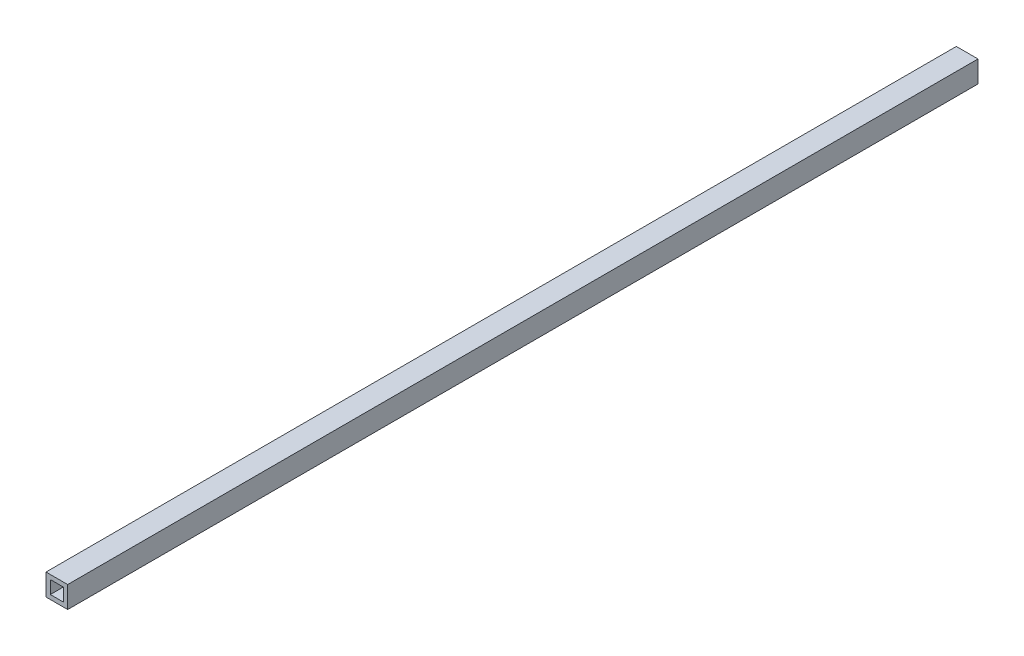
from build123d import *

# Parameters (mm, degrees)
SKETCH1_W                 = 50
SKETCH1_H                 = 50
SKETCH1_W_2               = 30
SKETCH1_H_2               = 30
BOSS_EXTRUDE1_DEPTH       = 2100
SKETCH2_W                 = 50
SKETCH2_H                 = 50
BOSS_EXTRUDE2_DEPTH       = 5100
SKETCH4_W                 = 50
SKETCH4_H                 = 50
SKETCH4_W_2               = 30
SKETCH4_H_2               = 30
BOSS_EXTRUDE3_DEPTH       = 2100
SKETCH5_W                 = 50
SKETCH5_H                 = 50
BOSS_EXTRUDE4_DEPTH       = 1800
LPATTERN1_COUNT           = 2
LPATTERN1_PITCH           = 2000
SKETCH6_W                 = 100
SKETCH6_H                 = 150
BOSS_EXTRUDE5_DEPTH       = 5
SKETCH7_W                 = 100
SKETCH7_H                 = 150
BOSS_EXTRUDE6_DEPTH       = 5
SKETCH8_W                 = 100
SKETCH8_H                 = 150
BOSS_EXTRUDE7_DEPTH       = 5
SKETCH9_W                 = 100
SKETCH9_H                 = 150
BOSS_EXTRUDE8_DEPTH       = 5
SKETCH10_W                = 100
SKETCH10_H                = 5
BOSS_EXTRUDE9_DEPTH       = 20
SKETCH11_W                = 100
SKETCH11_H                = 5
BOSS_EXTRUDE10_DEPTH      = 20
SKETCH12_W                = 100
SKETCH12_H                = 5
BOSS_EXTRUDE11_DEPTH      = 20
SKETCH13_W                = 100
SKETCH13_H                = 5
BOSS_EXTRUDE12_DEPTH      = 20
F_5_0MM_DOWEL_HOLE1_D     = 5
F_5_0MM_DOWEL_HOLE1_DEPTH = 20
F_5_0MM_DOWEL_HOLE1_TIP   = 1.502151548
F_5_0MM_DOWEL_HOLE2_D     = 5
F_5_0MM_DOWEL_HOLE2_DEPTH = 20
F_5_0MM_DOWEL_HOLE2_TIP   = 1.502151548
F_5_0MM_DOWEL_HOLE3_D     = 5
F_5_0MM_DOWEL_HOLE3_DEPTH = 20
F_5_0MM_DOWEL_HOLE3_TIP   = 1.502151548
F_5_0MM_DOWEL_HOLE4_D     = 5
F_5_0MM_DOWEL_HOLE4_DEPTH = 20
F_5_0MM_DOWEL_HOLE4_TIP   = 1.502151548
SKETCH26_W                = 5305.980467783
SKETCH26_H                = 67.779411833
CUT_EXTRUDE1_DEPTH        = 5613.586302232
SPLIT1_OUTLINE_W          = 5150
SPLIT1_OUTLINE_H          = 50
SPLIT1_OUTLINE_W_2        = 30
SPLIT1_OUTLINE_H_2        = 30
SPLIT1_DEPTH              = 2100
SPLIT1_START              = -5
SPLIT1_2_OUTLINE_W        = 100
SPLIT1_2_OUTLINE_H        = 120
SPLIT1_2_OUTLINE_R        = 2.5
SPLIT1_2_DEPTH            = 2110
SPLIT3_START              = -5
SPLIT3_OUTLINE_W          = 100
SPLIT3_OUTLINE_H          = 120
SPLIT3_OUTLINE_R          = 2.5
SPLIT3_DEPTH              = 5
SPLIT4_START              = 2100
SPLIT4_OUTLINE_W          = 100
SPLIT4_OUTLINE_H          = 120
SPLIT4_OUTLINE_R          = 2.5
SPLIT4_DEPTH              = 5


# Read off the part's stored shape, not the designer's step: Split1, Split3, Split4
with BuildPart() as part:
    # Sketch1 → Boss-Extrude1 (new body)
    with BuildSketch(Plane.XY):
        Rectangle(SKETCH1_W, SKETCH1_H)
        Rectangle(SKETCH1_W_2, SKETCH1_H_2, mode=Mode.SUBTRACT)
    extrude(amount=BOSS_EXTRUDE1_DEPTH)

    # Sketch2 → Boss-Extrude2 (add)
    with BuildSketch(Plane.ZY.offset(25)):
        with Locations((125, 0)):
            Rectangle(SKETCH2_W, SKETCH2_H)
        with Locations((1975, 0)):
            Rectangle(SKETCH2_W, SKETCH2_H)
    extrude(amount=BOSS_EXTRUDE2_DEPTH)

    # Sketch4 → Boss-Extrude3 (add)
    with BuildSketch(Plane.XY):
        with Locations((-5150, 0)):
            Rectangle(SKETCH4_W, SKETCH4_H)
        with Locations((-5150, 0)):
            Rectangle(SKETCH4_W_2, SKETCH4_H_2, mode=Mode.SUBTRACT)
    extrude(amount=BOSS_EXTRUDE3_DEPTH)

    # Sketch5 → Boss-Extrude4 (add)
    with BuildSketch(Plane(origin=(0, 0, 1950), x_dir=(-1, 0, 0), z_dir=(0, 0, -1))):
        with Locations((1550, 0)):
            Rectangle(SKETCH5_W, SKETCH5_H)
    boss_extrude4 = extrude(amount=BOSS_EXTRUDE4_DEPTH)

    # LPattern1: Boss-Extrude4 ×2
    with Locations(*[(-i * LPATTERN1_PITCH, 0, 0) for i in range(1, LPATTERN1_COUNT)]):
        add(boss_extrude4)

    # Sketch6 → Boss-Extrude5 (add)
    with BuildSketch(Plane(origin=(0, 0, 0), x_dir=(-1, 0, 0), z_dir=(0, 0, -1))):
        Rectangle(SKETCH6_W, SKETCH6_H)
    extrude(amount=BOSS_EXTRUDE5_DEPTH)

    # Sketch7 → Boss-Extrude6 (add)
    with BuildSketch(Plane(origin=(0, 0, 0), x_dir=(-1, 0, 0), z_dir=(0, 0, -1))):
        with Locations((5150, 0)):
            Rectangle(SKETCH7_W, SKETCH7_H)
    extrude(amount=BOSS_EXTRUDE6_DEPTH)

    # Sketch8 → Boss-Extrude7 (add)
    with BuildSketch(Plane.XY.offset(2100)):
        with Locations((-5150, 0)):
            Rectangle(SKETCH8_W, SKETCH8_H)
    extrude(amount=BOSS_EXTRUDE7_DEPTH)

    # Sketch9 → Boss-Extrude8 (add)
    with BuildSketch(Plane.XY.offset(2100)):
        Rectangle(SKETCH9_W, SKETCH9_H)
    extrude(amount=BOSS_EXTRUDE8_DEPTH)

    # Sketch10 → Boss-Extrude9 (add)
    with BuildSketch(Plane(origin=(0, 75, 0), x_dir=(1, 0, 0), z_dir=(0, 1, 0))):
        with Locations((0, -2102.5)):
            Rectangle(SKETCH10_W, SKETCH10_H)
    extrude(amount=BOSS_EXTRUDE9_DEPTH)

    # Sketch11 → Boss-Extrude10 (add)
    with BuildSketch(Plane(origin=(0, 75, 0), x_dir=(1, 0, 0), z_dir=(0, 1, 0))):
        with Locations((0, 2.5)):
            Rectangle(SKETCH11_W, SKETCH11_H)
    extrude(amount=BOSS_EXTRUDE10_DEPTH)

    # Sketch12 → Boss-Extrude11 (add)
    with BuildSketch(Plane(origin=(0, 75, 0), x_dir=(1, 0, 0), z_dir=(0, 1, 0))):
        with Locations((-5150, 2.5)):
            Rectangle(SKETCH12_W, SKETCH12_H)
    extrude(amount=BOSS_EXTRUDE11_DEPTH)

    # Sketch13 → Boss-Extrude12 (add)
    with BuildSketch(Plane(origin=(0, 75, 0), x_dir=(1, 0, 0), z_dir=(0, 1, 0))):
        with Locations((-5150, -2102.5)):
            Rectangle(SKETCH13_W, SKETCH13_H)
    extrude(amount=BOSS_EXTRUDE12_DEPTH)

    # Ø5.0mm Dowel Hole1
    with Locations(Plane(origin=(0, 0, -5), x_dir=(-1, 0, 0), z_dir=(0, 0, -1))):
        with Locations((5110, 75), (5190, 75), (5190, -15), (5110, -15)):
            Hole(F_5_0MM_DOWEL_HOLE1_D / 2, depth=F_5_0MM_DOWEL_HOLE1_DEPTH)
            with Locations((0, 0, -(F_5_0MM_DOWEL_HOLE1_DEPTH + F_5_0MM_DOWEL_HOLE1_TIP / 2))):  # 118° drill point
                Cone(0, F_5_0MM_DOWEL_HOLE1_D / 2, F_5_0MM_DOWEL_HOLE1_TIP, mode=Mode.SUBTRACT)

    # Ø5.0mm Dowel Hole2
    with Locations(Plane(origin=(0, 0, -5), x_dir=(-1, 0, 0), z_dir=(0, 0, -1))):
        with Locations((-40, -15), (-40, 75), (40, 75), (40, -15)):
            Hole(F_5_0MM_DOWEL_HOLE2_D / 2, depth=F_5_0MM_DOWEL_HOLE2_DEPTH)
            with Locations((0, 0, -(F_5_0MM_DOWEL_HOLE2_DEPTH + F_5_0MM_DOWEL_HOLE2_TIP / 2))):  # 118° drill point
                Cone(0, F_5_0MM_DOWEL_HOLE2_D / 2, F_5_0MM_DOWEL_HOLE2_TIP, mode=Mode.SUBTRACT)

    # Ø5.0mm Dowel Hole3
    with Locations(Plane.XY.offset(2105)):
        with Locations((-40, -15), (-40, 75), (40, 75), (40, -15)):
            Hole(F_5_0MM_DOWEL_HOLE3_D / 2, depth=F_5_0MM_DOWEL_HOLE3_DEPTH)
            with Locations((0, 0, -(F_5_0MM_DOWEL_HOLE3_DEPTH + F_5_0MM_DOWEL_HOLE3_TIP / 2))):  # 118° drill point
                Cone(0, F_5_0MM_DOWEL_HOLE3_D / 2, F_5_0MM_DOWEL_HOLE3_TIP, mode=Mode.SUBTRACT)

    # Ø5.0mm Dowel Hole4
    with Locations(Plane.XY.offset(2105)):
        with Locations((-5190, 75), (-5110, 75), (-5110, -15), (-5190, -15)):
            Hole(F_5_0MM_DOWEL_HOLE4_D / 2, depth=F_5_0MM_DOWEL_HOLE4_DEPTH)
            with Locations((0, 0, -(F_5_0MM_DOWEL_HOLE4_DEPTH + F_5_0MM_DOWEL_HOLE4_TIP / 2))):  # 118° drill point
                Cone(0, F_5_0MM_DOWEL_HOLE4_D / 2, F_5_0MM_DOWEL_HOLE4_TIP, mode=Mode.SUBTRACT)

    # Sketch26 → Cut-Extrude1 (cut, through all)
    with BuildSketch(Plane.XY.offset(2105)):
        with Locations((-2547.009766109, -58.889705917)):
            Rectangle(SKETCH26_W, SKETCH26_H)
    extrude(amount=-CUT_EXTRUDE1_DEPTH, mode=Mode.SUBTRACT)

    # Split1 outline → Split1 (cut)
    with BuildSketch(Plane.XY):
        with Locations((-2600, 0)):
            Rectangle(SPLIT1_OUTLINE_W, SPLIT1_OUTLINE_H)
        with Locations((-5150, 0)):
            Rectangle(SPLIT1_OUTLINE_W_2, SPLIT1_OUTLINE_H_2, mode=Mode.SUBTRACT)
    extrude(amount=SPLIT1_DEPTH, mode=Mode.SUBTRACT)

    # Split1 2 outline → Split1 2 (cut)
    with BuildSketch(Plane.XY.offset(SPLIT1_START)):
        with Locations((-5150, 35)):
            Rectangle(SPLIT1_2_OUTLINE_W, SPLIT1_2_OUTLINE_H)
        with Locations((-5190, -15)):
            Circle(SPLIT1_2_OUTLINE_R, mode=Mode.SUBTRACT)
        with Locations((-5190, 75)):
            Circle(SPLIT1_2_OUTLINE_R, mode=Mode.SUBTRACT)
        with Locations((-5110, 75)):
            Circle(SPLIT1_2_OUTLINE_R, mode=Mode.SUBTRACT)
        with Locations((-5110, -15)):
            Circle(SPLIT1_2_OUTLINE_R, mode=Mode.SUBTRACT)
    extrude(amount=SPLIT1_2_DEPTH, mode=Mode.SUBTRACT)

    # Split3 outline → Split3 (cut)
    with BuildSketch(Plane.XY.offset(SPLIT3_START)):
        with Locations((0, 35)):
            Rectangle(SPLIT3_OUTLINE_W, SPLIT3_OUTLINE_H)
        with Locations((-40, -15)):
            Circle(SPLIT3_OUTLINE_R, mode=Mode.SUBTRACT)
        with Locations((40, -15)):
            Circle(SPLIT3_OUTLINE_R, mode=Mode.SUBTRACT)
        with Locations((-40, 75)):
            Circle(SPLIT3_OUTLINE_R, mode=Mode.SUBTRACT)
        with Locations((40, 75)):
            Circle(SPLIT3_OUTLINE_R, mode=Mode.SUBTRACT)
    extrude(amount=SPLIT3_DEPTH, mode=Mode.SUBTRACT)

    # Split4 outline → Split4 (cut)
    with BuildSketch(Plane.XY.offset(SPLIT4_START)):
        with Locations((0, 35)):
            Rectangle(SPLIT4_OUTLINE_W, SPLIT4_OUTLINE_H)
        with Locations((-40, -15)):
            Circle(SPLIT4_OUTLINE_R, mode=Mode.SUBTRACT)
        with Locations((40, -15)):
            Circle(SPLIT4_OUTLINE_R, mode=Mode.SUBTRACT)
        with Locations((-40, 75)):
            Circle(SPLIT4_OUTLINE_R, mode=Mode.SUBTRACT)
        with Locations((40, 75)):
            Circle(SPLIT4_OUTLINE_R, mode=Mode.SUBTRACT)
    extrude(amount=SPLIT4_DEPTH, mode=Mode.SUBTRACT)


solid = part.part
